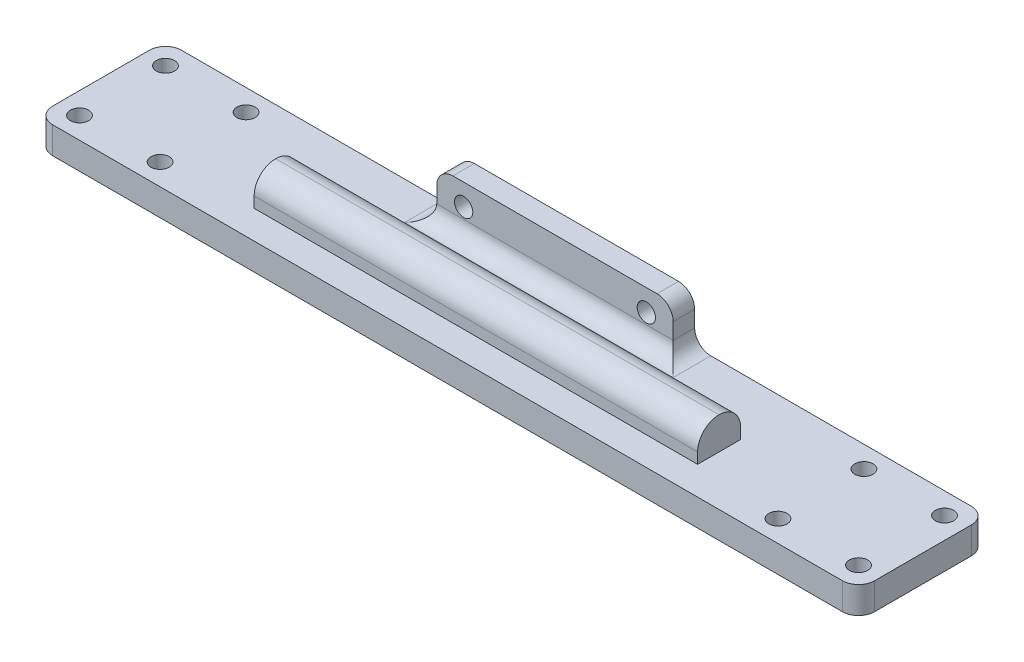
from build123d import *

# Parameters (mm, degrees)
SKETCH1_R           = 1.7
BOSS_EXTRUDE1_DEPTH = 5
FILLET1_R           = 3
SKETCH2_W           = 82.534528382
SKETCH2_H           = 8
BOSS_EXTRUDE2_DEPTH = 6
FILLET2_R           = 4
SKETCH3_W           = 22
SKETCH3_H           = 9
BOSS_EXTRUDE3_DEPTH = 4
FILLET3_R           = 3
SKETCH4_R           = 1.7
CUT_EXTRUDE2_DEPTH  = 4
FILLET4_R           = 3
FILLET5_R           = 3


with BuildPart() as part:
    # Sketch1 → Boss-Extrude1 (new body)
    with BuildSketch(Plane(origin=(0, 0, 0), x_dir=(1, 0, 0), z_dir=(0, 1, 0))):
        Polygon((-76.5, -12), (-53.5, -12), (53.5, -12), (76.5, -12), (76.5, 12), (53.5, 12), (-53.5, 12), (-76.5, 12), align=None)
        with Locations(Location((-72.5, 8, 0), (0, 0, 270))):
            Circle(SKETCH1_R, mode=Mode.SUBTRACT)
        with Locations(Location((-57.5, 8, 0), (0, 0, 270))):
            Circle(SKETCH1_R, mode=Mode.SUBTRACT)
        with Locations(Location((-57.5, -8, 0), (0, 0, 270))):
            Circle(SKETCH1_R, mode=Mode.SUBTRACT)
        with Locations(Location((-72.5, -8, 0), (0, 0, 270))):
            Circle(SKETCH1_R, mode=Mode.SUBTRACT)
        with Locations(Location((57.5, 8, 0), (0, 0, 270))):
            Circle(SKETCH1_R, mode=Mode.SUBTRACT)
        with Locations(Location((72.5, 8, 0), (0, 0, 270))):
            Circle(SKETCH1_R, mode=Mode.SUBTRACT)
        with Locations(Location((72.5, -8, 0), (0, 0, 270))):
            Circle(SKETCH1_R, mode=Mode.SUBTRACT)
        with Locations(Location((57.5, -8, 0), (0, 0, 270))):
            Circle(SKETCH1_R, mode=Mode.SUBTRACT)
    extrude(amount=BOSS_EXTRUDE1_DEPTH)

    # Fillet1
    fillet1_edges = [part.edges().sort_by_distance(p)[0] for p in [
        (-76.5, 2.5, 12),
        (-76.5, 2.5, -12),
        (76.5, 2.5, -12),
        (76.5, 2.5, 12),
    ]]
    fillet(fillet1_edges, radius=FILLET1_R)

    # Sketch2 → Boss-Extrude2 (add)
    with BuildSketch(Plane(origin=(0, 5, 0), x_dir=(1, 0, 0), z_dir=(0, 1, 0))):
        with Locations((0, -2.722781506)):
            Rectangle(SKETCH2_W, SKETCH2_H)
    extrude(amount=BOSS_EXTRUDE2_DEPTH)

    # Fillet2
    fillet2_edges = [part.edges().sort_by_distance(p)[0] for p in [
        (0, 11, 6.722781506),
        (0, 11, -1.277218494),
    ]]
    fillet(fillet2_edges, radius=FILLET2_R - 0.0001)  # a hair under: the kernel refuses the full size

    # Sketch3 → Boss-Extrude3 (add)
    with BuildSketch(Plane(origin=(0, 0, -12), x_dir=(-1, 0, 0), z_dir=(0, 0, -1))):
        with Locations((-11, 9.5)):
            Rectangle(SKETCH3_W, SKETCH3_H)
        with Locations((11, 9.5)):
            Rectangle(SKETCH3_W, SKETCH3_H)
    extrude(amount=-BOSS_EXTRUDE3_DEPTH)

    # Fillet3
    fillet3_edges = [part.edges().sort_by_distance(p)[0] for p in [
        (-22, 5, -10),
        (22, 5, -10),
    ]]
    fillet(fillet3_edges, radius=FILLET3_R)

    # Sketch4 → Cut-Extrude2 (cut)
    with BuildSketch(Plane(origin=(0, 0, -12), x_dir=(-1, 0, 0), z_dir=(0, 0, -1))):
        with BuildLine():
            ThreePointArc((-15.3, 10), (-15.797918472, 11.202081528), (-17, 11.7))
            Line((-17, 11.7), (-17, 10))
            Line((-17, 10), (-18.7, 10))
            ThreePointArc((-18.7, 10), (-17, 8.3), (-15.3, 10))
        make_face()
        with BuildLine():
            Line((-17, 10), (-17, 11.7))
            ThreePointArc((-17, 11.7), (-18.202081528, 11.202081528), (-18.7, 10))
            Line((-18.7, 10), (-17, 10))
        make_face()
        with Locations((17, 10)):
            Circle(SKETCH4_R)
    extrude(amount=-CUT_EXTRUDE2_DEPTH, mode=Mode.SUBTRACT)

    # Fillet4
    fillet4_edges = [part.edges().sort_by_distance(p)[0] for p in [
        (22, 14, -10),
        (-22, 14, -10),
    ]]
    fillet(fillet4_edges, radius=FILLET4_R)

    # Fillet5
    fillet5_edges = [part.edges().sort_by_distance(p)[0] for p in [
        (0, 5, -8),
    ]]
    fillet(fillet5_edges, radius=FILLET5_R)


solid = part.part
